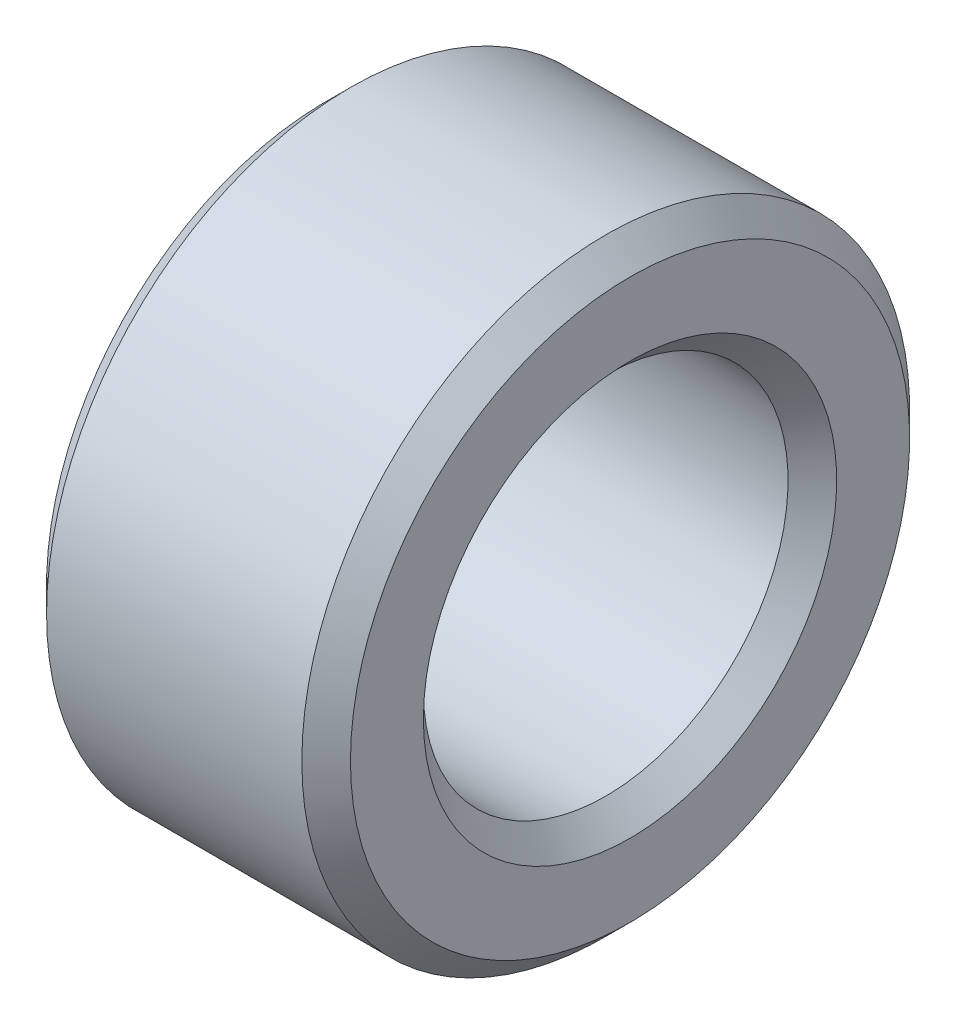
from build123d import *

# Parameters (mm, degrees)
SKETCH1_W     = 2.5
SKETCH1_H     = 1
CHAMFER1_SIZE = 0.2


with BuildPart() as part:
    # Sketch1 → Revolve1 (revolve)
    with BuildSketch(Plane.XY):
        with Locations((1.25, 2)):
            Rectangle(SKETCH1_W, SKETCH1_H)
    revolve(axis=Axis((0, 0, 0), (1, 0, 0)))

    # Chamfer1
    chamfer1_edges = [part.edges().sort_by_distance(p)[0] for p in [
        (0, -2.5, 0),
        (2.5, -2.5, 0),
        (2.5, -1.5, 0),
        (0, -1.5, 0),
    ]]
    chamfer(chamfer1_edges, length=CHAMFER1_SIZE)


solid = part.part
